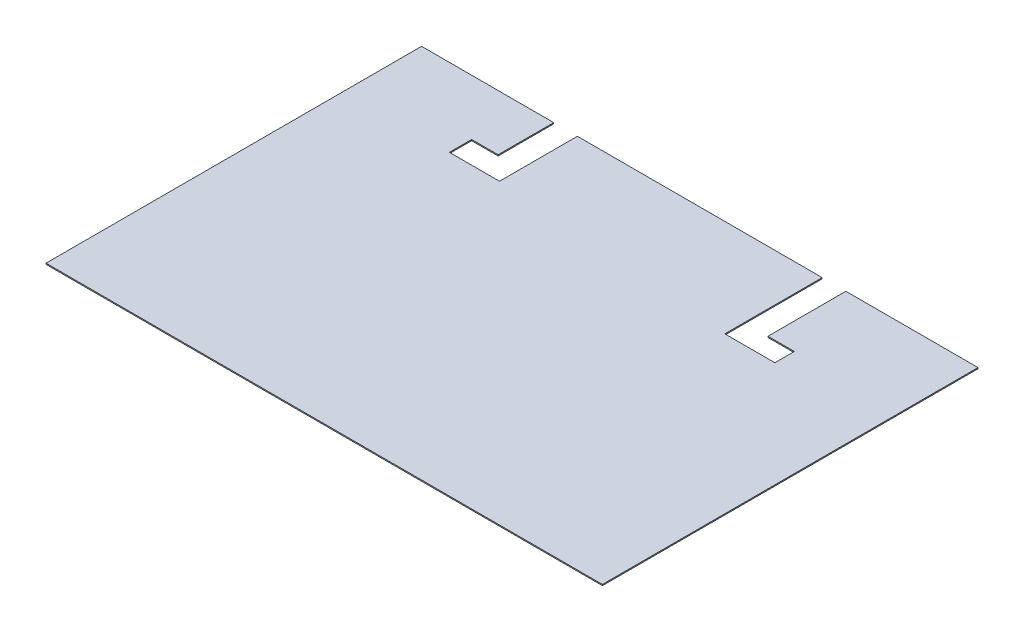
from build123d import *

# Parameters (mm, degrees)
SKETCH1_W           = 25.4
SKETCH1_H           = 17.145
BOSS_EXTRUDE1_DEPTH = 0.0508
CUT_EXTRUDE1_DEPTH  = 31.644960526


with BuildPart() as part:
    # Sketch1 → Boss-Extrude1 (new body)
    with BuildSketch(Plane(origin=(0, 0, 0), x_dir=(1, 0, 0), z_dir=(0, 1, 0))):
        with Locations((12.7, 8.5725)):
            Rectangle(SKETCH1_W, SKETCH1_H)
    extrude(amount=BOSS_EXTRUDE1_DEPTH)

    # Sketch2 → Cut-Extrude1 (cut, through all)
    with BuildSketch(Plane(origin=(0, 0.0508, 0), x_dir=(1, 0, 0), z_dir=(0, 1, 0))):
        Polygon((6.0325, 17.145), (7.112, 17.145), (7.112, 13.589), (4.826, 13.589), (4.826, 14.605), (6.0325, 14.605), align=None)
        Polygon((18.288, 17.145), (19.3675, 17.145), (19.3675, 13.589), (20.574, 13.589), (20.574, 12.7), (18.288, 12.7), align=None)
    extrude(amount=-CUT_EXTRUDE1_DEPTH, mode=Mode.SUBTRACT)


solid = part.part
